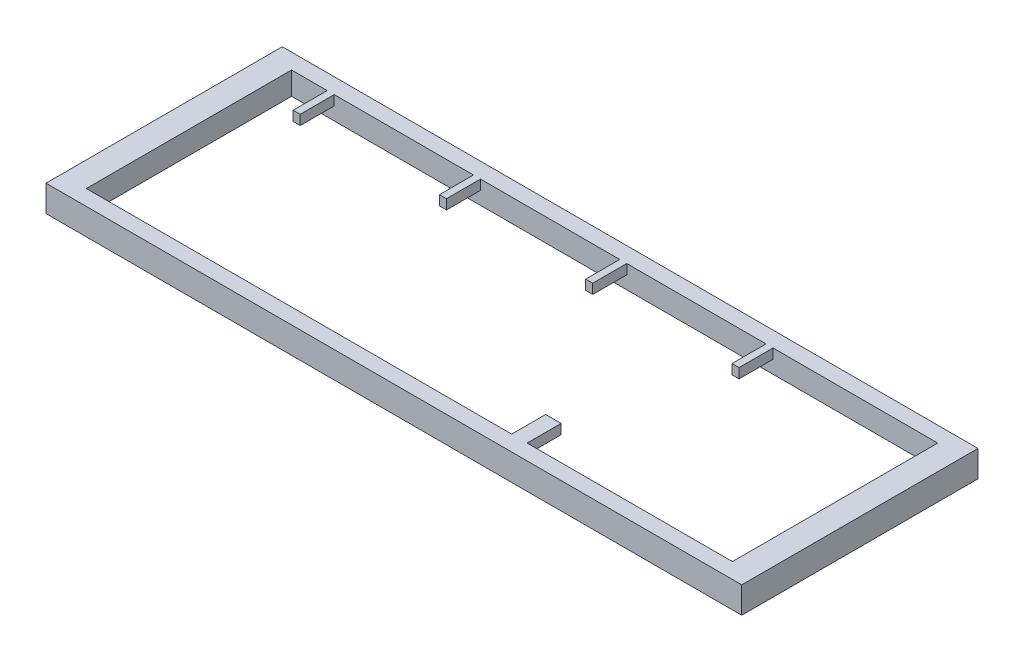
from build123d import *

# Parameters (mm, degrees)
SKETCH1_W             = 390.74
SKETCH1_H             = 132.7
SKETCH1_W_2           = 362.9
SKETCH1_H_2           = 115.3
MAIN_BODY_DEPTH       = 14.8
SKETCH2_W             = 386.74
SKETCH2_H             = 128.7
ALIGNMENT_GUIDE_DEPTH = 2
SKETCH3_W             = 8.7
SKETCH3_H             = 19.1
SKETCH3_W_2           = 3.95
BLOCKERS_DEPTH        = 5.5


with BuildPart() as part:
    # Sketch1 → Main Body (new body)
    with BuildSketch(Plane(origin=(0, 0, 0), x_dir=(1, 0, 0), z_dir=(0, 1, 0))):
        with Locations((195.37, 66.35)):
            Rectangle(SKETCH1_W, SKETCH1_H)
        with Locations((195.37, 66.35)):
            Rectangle(SKETCH1_W_2, SKETCH1_H_2, mode=Mode.SUBTRACT)
    extrude(amount=MAIN_BODY_DEPTH)

    # Sketch2 → Alignment Guide (cut)
    with BuildSketch(Plane.XZ):
        with Locations((195.37, -66.35)):
            Rectangle(SKETCH2_W, SKETCH2_H)
    extrude(amount=-ALIGNMENT_GUIDE_DEPTH, mode=Mode.SUBTRACT)

    # Sketch3 → Blockers (add)
    with BuildSketch(Plane(origin=(0, 14.8, 0), x_dir=(1, 0, 0), z_dir=(0, 1, 0))):
        with Locations((257.17, 18.25)):
            Rectangle(SKETCH3_W, SKETCH3_H)
        with Locations((35.895, 114.45)):
            Rectangle(SKETCH3_W_2, SKETCH3_H)
        with Locations((118.045, 114.45)):
            Rectangle(SKETCH3_W_2, SKETCH3_H)
        with Locations((200.195, 114.45)):
            Rectangle(SKETCH3_W_2, SKETCH3_H)
        with Locations((282.345, 114.45)):
            Rectangle(SKETCH3_W_2, SKETCH3_H)
    extrude(amount=-BLOCKERS_DEPTH)


solid = part.part
